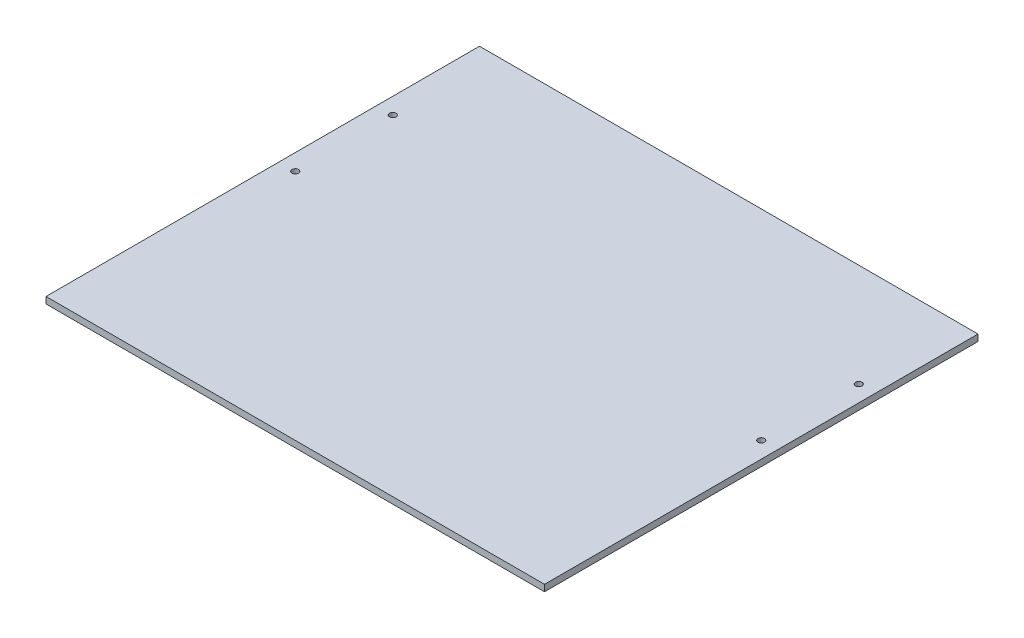
from build123d import *

# Parameters (mm, degrees)
ESBO_O1_W                = 230
ESBO_O1_H                = 200
ESBO_O1_R                = 1.5
RESSALTO_EXTRUS_O1_DEPTH = 3


with BuildPart() as part:
    # Esboço1 → Ressalto-extrusão1 (new body)
    with BuildSketch(Plane(origin=(0, 0, 0), x_dir=(1, 0, 0), z_dir=(0, 1, 0))):
        Rectangle(ESBO_O1_W, ESBO_O1_H)
        with Locations((-107.5, 52.5)):
            Circle(ESBO_O1_R, mode=Mode.SUBTRACT)
        with Locations((-107.5, 7.5)):
            Circle(ESBO_O1_R, mode=Mode.SUBTRACT)
        with Locations((107.5, 7.5)):
            Circle(ESBO_O1_R, mode=Mode.SUBTRACT)
        with Locations((107.5, 52.5)):
            Circle(ESBO_O1_R, mode=Mode.SUBTRACT)
    extrude(amount=RESSALTO_EXTRUS_O1_DEPTH)


solid = part.part
